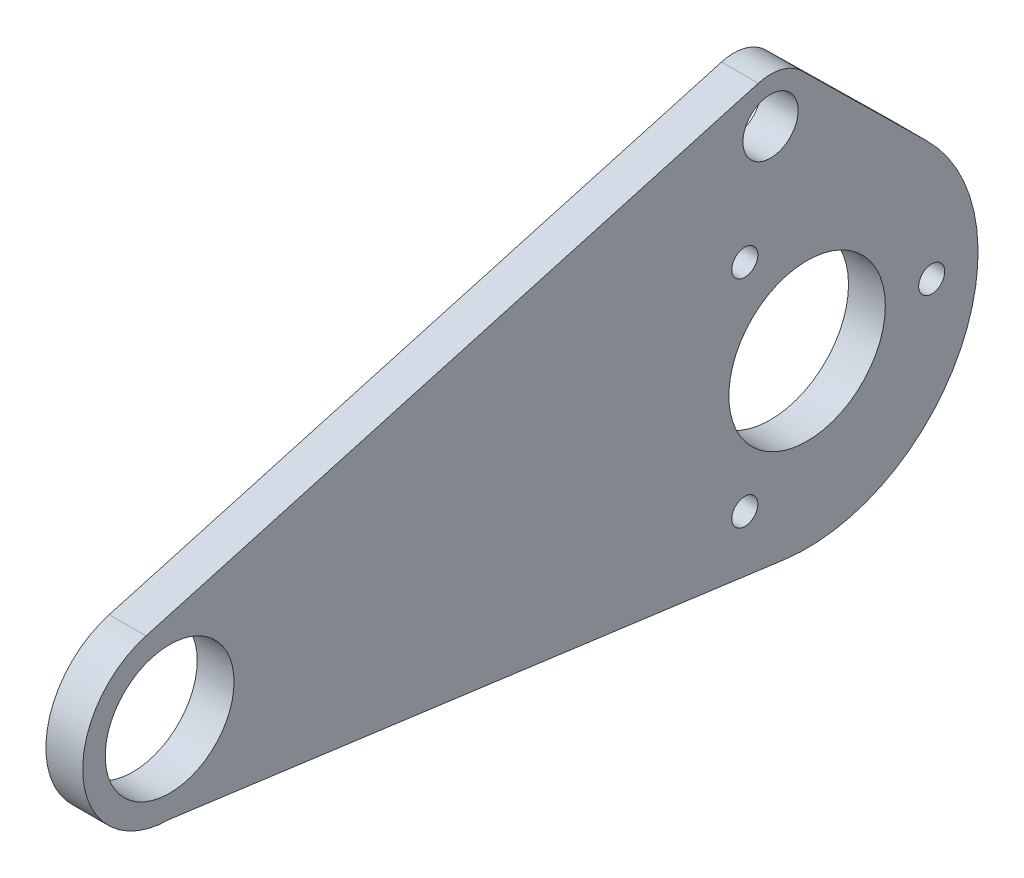
from build123d import *

# Parameters (mm, degrees)
SKETCH1_R            = 11.1125
SKETCH1_R_2          = 13.5
SKETCH1_R_3          = 4.7625
BOSS_EXTRUDE1_DEPTH  = 3.175
M4_CLEARANCE_HOLE1_D = 4.5


with BuildPart() as part:
    # Sketch1 → Boss-Extrude1 (new, symmetric)
    with BuildSketch(Plane(origin=(0, 0, 0), x_dir=(0, 0, -1), z_dir=(1, 0, 0))):
        with BuildLine():
            Line((101.584158555, 44.195897144), (-4.066677309, 14.438217884))
            ThreePointArc((-4.066677309, 14.438217884), (-14.858890744, -2.052648501), (0, -15))
            Line((0, -15), (106.075609583, -29.237803609))
            ThreePointArc((106.075609583, -29.237803609), (136.491140548, -12.979579055), (130.699290202, 21.018786481))
            Line((130.699290202, 21.018786481), (109.135384069, 42.254910239))
            ThreePointArc((109.135384069, 42.254910239), (105.621138378, 44.242227481), (101.584158555, 44.195897144))
        make_face()
        Circle(SKETCH1_R, mode=Mode.SUBTRACT)
        with Locations((110, 0)):
            Circle(SKETCH1_R_2, mode=Mode.SUBTRACT)
        with Locations((103.688664063, 36.724119389)):
            Circle(SKETCH1_R_3, mode=Mode.SUBTRACT)
    extrude(amount=BOSS_EXTRUDE1_DEPTH, both=True)

    # M4 Clearance Hole1 (through all)
    with Locations(Plane(origin=(3.175, 0, 0), x_dir=(0, 0, -1), z_dir=(1, 0, 0))):
        with Locations((99.25, 18.619546181), (131.5, 0), (99.25, -18.619546181)):
            Hole(M4_CLEARANCE_HOLE1_D / 2)


solid = part.part
